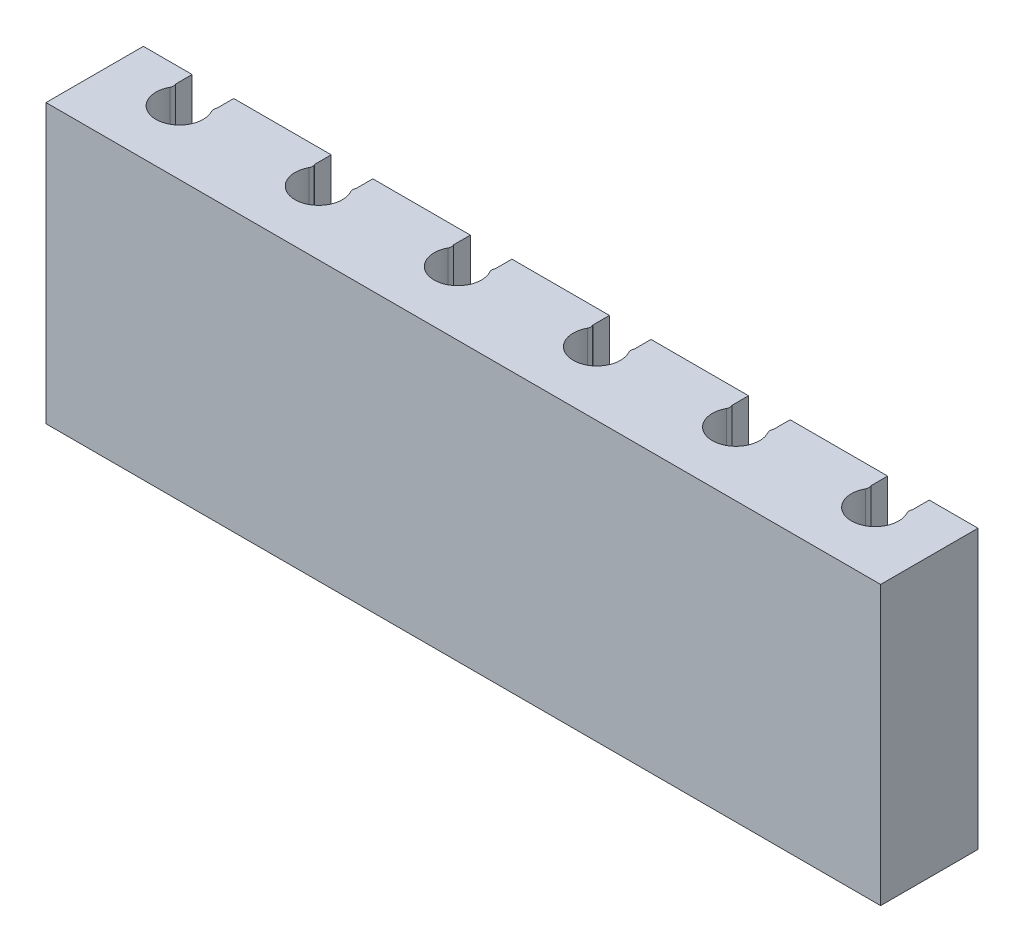
from build123d import *

# Parameters (mm, degrees)
BOSS_EXTRUDE1_DEPTH = 10
FILLET1_R           = 0.2
BOSS_EXTRUDE2_START = -0.1
SKETCH2_W           = 1.752559166
SKETCH2_H           = 10
BOSS_EXTRUDE2_DEPTH = 0.6
LPATTERN1_DEPTH     = 10


# Read off the part's stored shape, not the designer's step: LPattern1
with BuildPart() as part:
    # Sketch1 → Boss-Extrude1 (new body)
    with BuildSketch(Plane(origin=(0, 0, 0), x_dir=(1, 0, 0), z_dir=(0, 1, 0))):
        with BuildLine():
            Line((0, 3), (0, 0))
            Line((0, 0), (5, 0))
            Line((5, 0), (5, 3))
            Line((5, 3), (2.982182538, 3))
            ThreePointArc((2.982182538, 3), (3.252447725, 2.695376303), (3.35, 2.3))
            ThreePointArc((3.35, 2.3), (2.104623697, 1.547552275), (2.017817462, 3))
            Line((2.017817462, 3), (0, 3))
        make_face()
    extrude(amount=BOSS_EXTRUDE1_DEPTH)

    # Fillet1
    fillet1_edges = [part.edges().sort_by_distance(p)[0] for p in [
        (2.982182538, 5, -3),
        (2.017817462, 5, -3),
    ]]
    fillet(fillet1_edges, radius=FILLET1_R)

    # Sketch2 → Boss-Extrude2 (add)
    with BuildSketch(Plane(origin=(0, 0, -3), x_dir=(-1, 0, 0), z_dir=(0, 0, -1)).offset(BOSS_EXTRUDE2_START)):
        with Locations((-0.876279583, 5)):
            Rectangle(SKETCH2_W, SKETCH2_H)
        with Locations((-4.123720417, 5)):
            Rectangle(SKETCH2_W, SKETCH2_H)
    extrude(amount=BOSS_EXTRUDE2_DEPTH)

    # LPattern1 outline → LPattern1 (add)
    with BuildSketch(Plane(origin=(0, 0, 0), x_dir=(1, 0, 0), z_dir=(0, 1, 0))):
        with BuildLine():
            ThreePointArc((28.250104185, 2.9), (28.223327872, 2.802728057), (28.247440834, 2.704761905))
            ThreePointArc((28.247440834, 2.704761905), (27.5, 1.45), (26.752559166, 2.704761905))
            ThreePointArc((26.752559166, 2.704761905), (26.776672128, 2.802728057), (26.749895815, 2.9))
            Line((26.749895815, 2.9), (26.752559166, 2.9))
            Line((26.752559166, 2.9), (26.752559166, 3.5))
            Line((26.752559166, 3.5), (23.247440834, 3.5))
            Line((23.247440834, 3.5), (23.247440834, 2.9))
            Line((23.247440834, 2.9), (23.250104185, 2.9))
            ThreePointArc((23.250104185, 2.9), (23.223327872, 2.802728057), (23.247440834, 2.704761905))
            ThreePointArc((23.247440834, 2.704761905), (22.5, 1.45), (21.752559166, 2.704761905))
            ThreePointArc((21.752559166, 2.704761905), (21.776672128, 2.802728057), (21.749895815, 2.9))
            Line((21.749895815, 2.9), (21.752559166, 2.9))
            Line((21.752559166, 2.9), (21.752559166, 3.5))
            Line((21.752559166, 3.5), (18.247440834, 3.5))
            Line((18.247440834, 3.5), (18.247440834, 2.9))
            Line((18.247440834, 2.9), (18.250104185, 2.9))
            ThreePointArc((18.250104185, 2.9), (18.223327872, 2.802728057), (18.247440834, 2.704761905))
            ThreePointArc((18.247440834, 2.704761905), (17.5, 1.45), (16.752559166, 2.704761905))
            ThreePointArc((16.752559166, 2.704761905), (16.776672128, 2.802728057), (16.749895815, 2.9))
            Line((16.749895815, 2.9), (16.752559166, 2.9))
            Line((16.752559166, 2.9), (16.752559166, 3.5))
            Line((16.752559166, 3.5), (13.247440834, 3.5))
            Line((13.247440834, 3.5), (13.247440834, 2.9))
            Line((13.247440834, 2.9), (13.250104185, 2.9))
            ThreePointArc((13.250104185, 2.9), (13.223327872, 2.802728057), (13.247440834, 2.704761905))
            ThreePointArc((13.247440834, 2.704761905), (12.5, 1.45), (11.752559166, 2.704761905))
            ThreePointArc((11.752559166, 2.704761905), (11.776672128, 2.802728057), (11.749895815, 2.9))
            Line((11.749895815, 2.9), (11.752559166, 2.9))
            Line((11.752559166, 2.9), (11.752559166, 3.5))
            Line((11.752559166, 3.5), (8.247440834, 3.5))
            Line((8.247440834, 3.5), (8.247440834, 2.9))
            Line((8.247440834, 2.9), (8.250104185, 2.9))
            ThreePointArc((8.250104185, 2.9), (8.223327872, 2.802728057), (8.247440834, 2.704761905))
            ThreePointArc((8.247440834, 2.704761905), (7.5, 1.45), (6.752559166, 2.704761905))
            ThreePointArc((6.752559166, 2.704761905), (6.776672128, 2.802728057), (6.749895815, 2.9))
            Line((6.749895815, 2.9), (6.752559166, 2.9))
            Line((6.752559166, 2.9), (6.752559166, 3.5))
            Line((6.752559166, 3.5), (5, 3.5))
            Line((5, 3.5), (5, 0))
            Line((5, 0), (30, 0))
            Line((30, 0), (30, 3.5))
            Line((30, 3.5), (28.247440834, 3.5))
            Line((28.247440834, 3.5), (28.247440834, 2.9))
            Line((28.247440834, 2.9), (28.250104185, 2.9))
        make_face()
    extrude(amount=LPATTERN1_DEPTH)


solid = part.part
